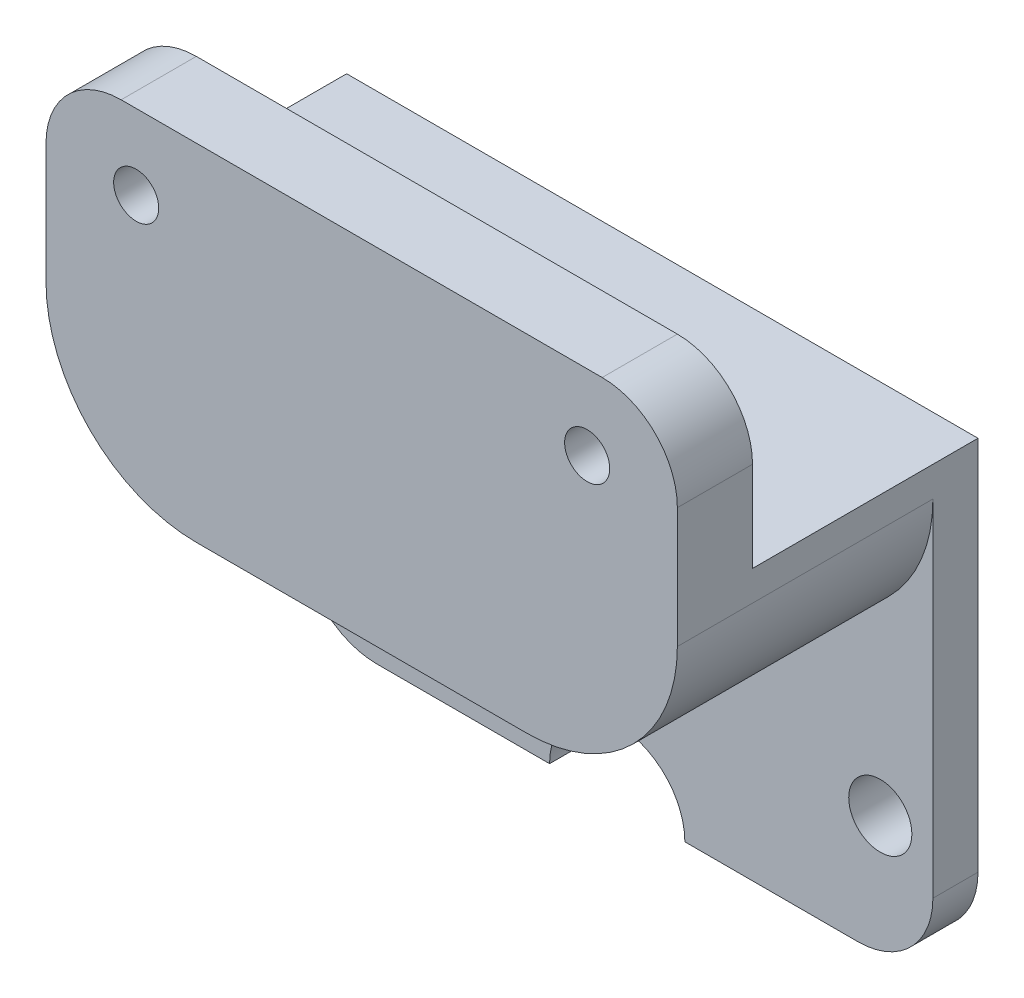
from build123d import *

# Parameters (mm, degrees)
SKETCH3_R           = 1.5
BOSS_EXTRUDE3_DEPTH = 5
BOSS_EXTRUDE4_START = -15
BOSS_EXTRUDE4_DEPTH = 15
FILLET4_R           = 5
SKETCH9_W           = 42
SKETCH9_H           = 3
BOSS_EXTRUDE7_DEPTH = 30
FILLET6_R           = 5
FILLET7_R           = 5
SKETCH11_R          = 2.1
CUT_EXTRUDE2_DEPTH  = 30


with BuildPart() as part:
    # Sketch3 → Boss-Extrude3 (new body)
    with BuildSketch(Plane.XY):
        with BuildLine():
            Line((-22.592834793, 16.50935751), (-6.092834793, 16.50935751))
            Line((-6.092834793, 16.50935751), (-6.092834793, 3.50935751))
            ThreePointArc((-6.092834793, 3.50935751), (-9.021766981, -3.561710302), (-16.092834793, -6.49064249))
            Line((-16.092834793, -6.49064249), (-38.092834793, -6.49064249))
            ThreePointArc((-38.092834793, -6.49064249), (-45.163902605, -3.561710302), (-48.092834793, 3.50935751))
            Line((-48.092834793, 3.50935751), (-48.092834793, 16.50935751))
            Line((-48.092834793, 16.50935751), (-31.592834793, 16.50935751))
            Line((-31.592834793, 16.50935751), (-22.592834793, 16.50935751))
        make_face()
        with Locations((-42.092834793, 11.50935751)):
            Circle(SKETCH3_R, mode=Mode.SUBTRACT)
        with Locations((-12.092834793, 11.50935751)):
            Circle(SKETCH3_R, mode=Mode.SUBTRACT)
    extrude(amount=BOSS_EXTRUDE3_DEPTH)

    # Sketch6 → Boss-Extrude4 (add)
    with BuildSketch(Plane.XY.offset(BOSS_EXTRUDE4_START)):
        with BuildLine():
            Line((-48.092834793, 5.50935751), (-48.092834793, 3.50935751))
            ThreePointArc((-48.092834793, 3.50935751), (-45.163902605, -3.561710302), (-38.092834793, -6.49064249))
            Line((-38.092834793, -6.49064249), (-16.092834793, -6.49064249))
            ThreePointArc((-16.092834793, -6.49064249), (-9.021766981, -3.561710302), (-6.092834793, 3.50935751))
            Line((-6.092834793, 3.50935751), (-6.092834793, 5.50935751))
            Line((-6.092834793, 5.50935751), (-48.092834793, 5.50935751))
        make_face()
    extrude(amount=BOSS_EXTRUDE4_DEPTH)

    # Fillet4
    fillet4_edges = [part.edges().sort_by_distance(p)[0] for p in [
        (-48.092834793, 16.50935751, 2.5),
        (-6.092834793, 16.50935751, 2.5),
    ]]
    fillet(fillet4_edges, radius=FILLET4_R)

    # Sketch9 → Boss-Extrude7 (add)
    with BuildSketch(Plane(origin=(0, 5.50935751, 0), x_dir=(1, 0, 0), z_dir=(0, 1, 0))):
        with Locations((-27.092834793, 13.5)):
            Rectangle(SKETCH9_W, SKETCH9_H)
    extrude(amount=-BOSS_EXTRUDE7_DEPTH)

    # Fillet6
    fillet6_edges = [part.edges().sort_by_distance(p)[0] for p in [
        (-6.092834793, -24.49064249, -13.5),
    ]]
    fillet(fillet6_edges, radius=FILLET6_R)

    # Fillet7
    fillet7_edges = [part.edges().sort_by_distance(p)[0] for p in [
        (-48.092834793, -24.49064249, -13.5),
    ]]
    fillet(fillet7_edges, radius=FILLET7_R)

    # Sketch11 → Cut-Extrude2 (cut)
    with BuildSketch(Plane(origin=(0, 0, -15), x_dir=(-1, 0, 0), z_dir=(0, 0, -1))):
        with Locations((9.592834793, -16.49064249)):
            Circle(SKETCH11_R)
        with Locations((44.592834793, -16.49064249)):
            Circle(SKETCH11_R)
        with BuildLine():
            Line((22.592834793, -24.49064249), (31.592834793, -24.49064249))
            ThreePointArc((31.592834793, -24.49064249), (27.092834793, -19.99064249), (22.592834793, -24.49064249))
        make_face()
    extrude(amount=-CUT_EXTRUDE2_DEPTH, mode=Mode.SUBTRACT)


solid = part.part
